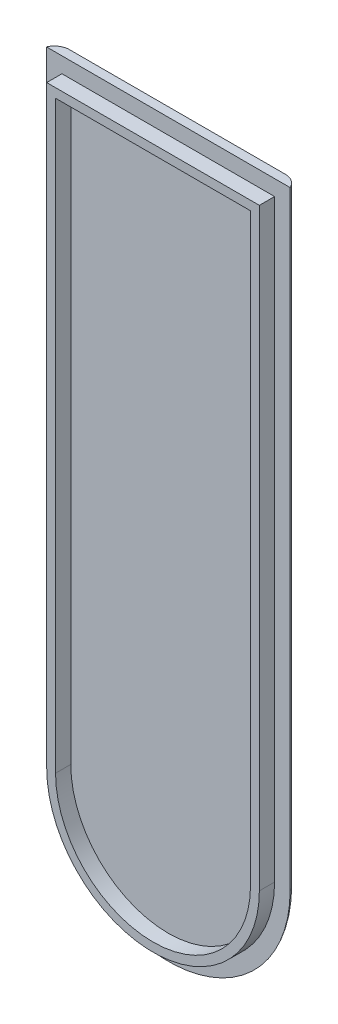
from build123d import *

# Parameters (mm, degrees)
RESSALTO_EXTRUS_O1_DEPTH = 3
RESSALTO_EXTRUS_O2_DEPTH = 5
FILETE1_R                = 5


with BuildPart() as part:
    # Esboço1 → Ressalto-extrusão1 (new body)
    with BuildSketch(Plane.XY):
        with BuildLine():
            Line((-40, 0), (-40, 200))
            Line((-40, 200), (40, 200))
            Line((40, 200), (40, 0))
            ThreePointArc((40, 0), (0, -40), (-40, 0))
        make_face()
    extrude(amount=RESSALTO_EXTRUS_O1_DEPTH)

    # Esboço2 → Ressalto-extrusão2 (add)
    with BuildSketch(Plane.XY.offset(3)):
        with BuildLine():
            Line((-34.9, 0), (-34.9, 194.9))
            Line((-34.9, 194.9), (34.9, 194.9))
            Line((34.9, 194.9), (34.9, 0))
            ThreePointArc((34.9, 0), (0, -34.9), (-34.9, 0))
        make_face()
        with BuildLine():
            Line((32, 0), (32, 191.9))
            Line((32, 191.9), (-32, 191.9))
            Line((-32, 191.9), (-32, 0))
            ThreePointArc((-32, 0), (0, -32), (32, 0))
        make_face(mode=Mode.SUBTRACT)
    extrude(amount=RESSALTO_EXTRUS_O2_DEPTH)

    # Filete1
    # the kernel refuses this fillet: 5 mm, written as the material it takes off along each edge
    with BuildSketch(Plane(origin=(40, 211.456439237, 0), x_dir=(-1, 0, 0), z_dir=(0, -1, 0))) as filete1_piece_1:
        with BuildLine():
            CenterArc((4.582575695, -5), FILETE1_R, 90, 66.421821522)
            Line((0, -3), (-0.091651514, -2.96))
            ThreePointArc((-0.091651514, -2.96), (-0.1, -1.5), (-0.1, 0))
            Line((-0.1, 0), (0, 0.1))
            Line((0, 0.1), (4.582575695, 0.1))
            Line((4.582575695, 0.1), (4.582575695, 0))
        make_face()
    extrude(amount=211.456439237, mode=Mode.SUBTRACT)
    with BuildSketch(Plane(origin=(0, 0, 0), x_dir=(1, 0, 0), z_dir=(0, 1, 0))) as filete1_piece_2:
        with BuildLine():
            CenterArc((35.417424305, -5), FILETE1_R, 23.578178478, 66.421821522)
            Line((35.417424305, 0), (35.417424305, 0.1))
            Line((35.417424305, 0.1), (40, 0.1))
            Line((40, 0.1), (40.1, 0))
            ThreePointArc((40.1, 0), (40.1, -1.5), (40.091651514, -2.96))
            Line((40.091651514, -2.96), (40, -3))
        make_face()
    revolve(axis=Axis((0, 0, 0), (0, 0, -1)), revolution_arc=180, mode=Mode.SUBTRACT)
    with BuildSketch(Plane(origin=(-40, 0, 0), x_dir=(0, 0, 1), z_dir=(0, 1, 0))) as filete1_piece_3:
        with BuildLine():
            CenterArc((5, 4.582575695), FILETE1_R, 180, 66.421821522)
            Line((0, 4.582575695), (-0.1, 4.582575695))
            Line((-0.1, 4.582575695), (-0.1, 0))
            Line((-0.1, 0), (0, -0.1))
            ThreePointArc((0, -0.1), (1.5, -0.1), (2.96, -0.091651514))
            Line((2.96, -0.091651514), (3, 0))
        make_face()
    extrude(amount=211.456439237, mode=Mode.SUBTRACT)


solid = part.part
